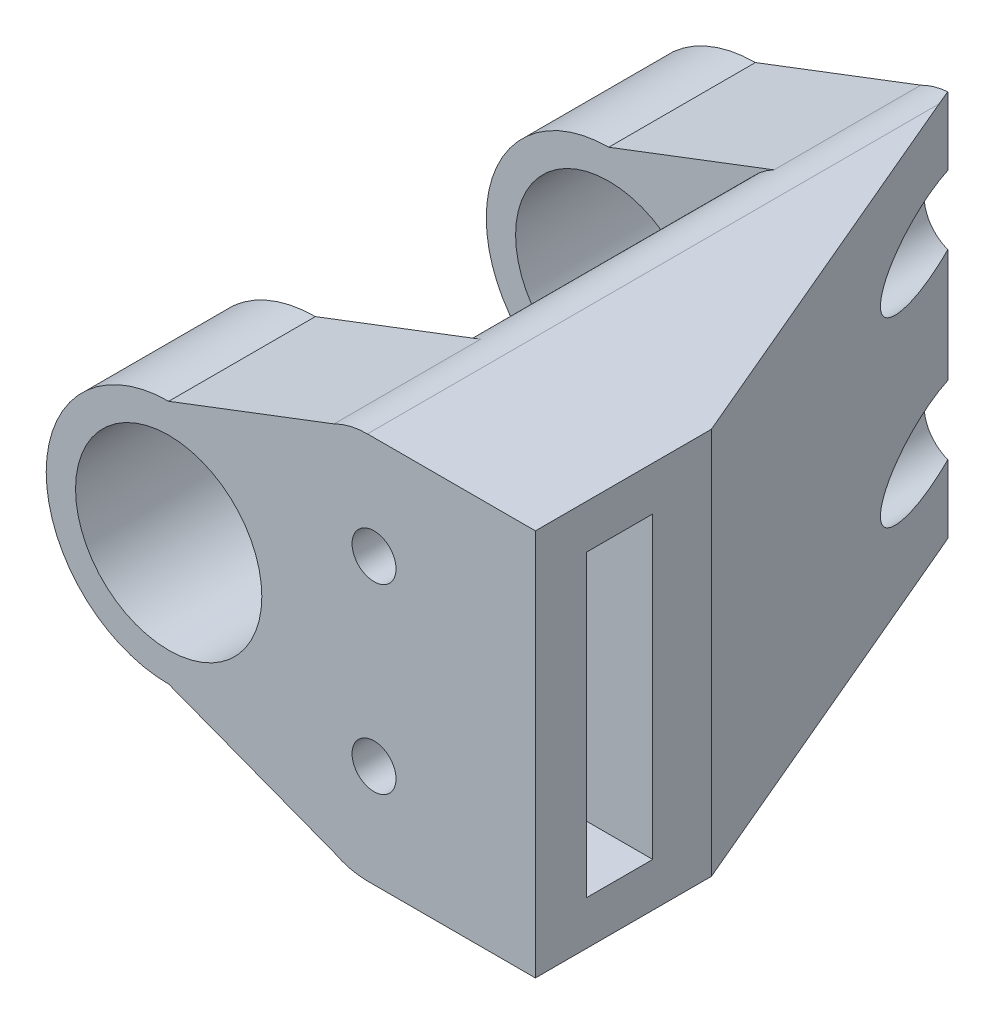
from build123d import *

# Parameters (mm, degrees)
SKETCH1_R               = 6.35
SKETCH1_W               = 15
SKETCH1_H               = 20.4
SKETCH1_R_2             = 1.5
BOSS_EXTRUDE1_DEPTH     = 40
CUT_EXTRUDE1_START      = -3.5
SKETCH1_7_W             = 15
SKETCH1_7_H             = 20.4
SKETCH1_7_R             = 1.5
CUT_EXTRUDE1_DEPTH      = 4.5
CUT_EXTRUDE2_START      = -10
CUT_EXTRUDE2_DEPTH      = 20
FILLET1_R               = 5
CUT_EXTRUDE3_DEPTH      = 39.804456485
CUT_EXTRUDE3_DEPTH_BACK = 39.804456485
CHAMFER1_SIZE           = 28
CHAMFER1_SIZE_2         = 11.885294854
CUT_EXTRUDE5_DEPTH      = 46.945211938
CUT_EXTRUDE5_DEPTH_BACK = 20
SKETCH5_R               = 2.5


with BuildPart() as part:
    # Sketch1 → Boss-Extrude1 (new body)
    # profile 1 of 2: a face of its own
    with BuildSketch(Plane.XY):
        Polygon((-20.773681501, -13.2), (-15, -13.2), (15, -13.2), (15, -10.2), (0, -10.2), (0, 10.2), (15, 10.2), (15, 13.2), (-14.707827622, 13.2), (-15, 13.2), (-20.773681501, 13.2), align=None)
        with Locations((-10, 0)):
            Circle(SKETCH1_R, mode=Mode.SUBTRACT)
    # profile 2 of 2: a face of its own
    with BuildSketch(Plane.XY):
        with Locations((7.5, 0)):
            Rectangle(SKETCH1_W, SKETCH1_H)
        with Locations((4, -6.2)):
            Circle(SKETCH1_R_2, mode=Mode.SUBTRACT)
        with Locations((4, 6.2)):
            Circle(SKETCH1_R_2, mode=Mode.SUBTRACT)
    extrude(amount=-BOSS_EXTRUDE1_DEPTH)

    # Sketch1<7> → Cut-Extrude1 (cut)
    with BuildSketch(Plane.XY.offset(CUT_EXTRUDE1_START)):
        with Locations((7.5, 0)):
            Rectangle(SKETCH1_7_W, SKETCH1_7_H)
        with Locations((4, -6.2)):
            Circle(SKETCH1_7_R, mode=Mode.SUBTRACT)
        with Locations((4, 6.2)):
            Circle(SKETCH1_7_R, mode=Mode.SUBTRACT)
    extrude(amount=-CUT_EXTRUDE1_DEPTH, mode=Mode.SUBTRACT)

    # Sketch2 → Cut-Extrude2 (cut)
    with BuildSketch(Plane.XY.offset(CUT_EXTRUDE2_START)):
        with BuildLine():
            Line((-0.235583945, 2.157818136), (-2.675772908, 13.2))
            Line((-2.675772908, 13.2), (-11.927619652, 13.2))
            Line((-11.927619652, 13.2), (-20.773681501, 13.2))
            Line((-20.773681501, 13.2), (-20.773681501, -13.2))
            Line((-20.773681501, -13.2), (-2.675772908, -13.2))
            Line((-2.675772908, -13.2), (-0.235583945, -2.157818136))
            ThreePointArc((-0.235583945, -2.157818136), (0, 0), (-0.235583945, 2.157818136))
        make_face()
    extrude(amount=-CUT_EXTRUDE2_DEPTH, mode=Mode.SUBTRACT)

    # Fillet1
    fillet1_edges = [part.edges().sort_by_distance(p)[0] for p in [
        (-2.675772908, 13.2, -20),
        (-2.675772908, -13.2, -20),
    ]]
    fillet(fillet1_edges, radius=FILLET1_R)

    # Sketch3 → Cut-Extrude3 (cut, two sides: drawn at the far end of the back side and taken through both)
    with BuildSketch(Plane.XY.offset(-30).offset(-CUT_EXTRUDE3_DEPTH_BACK)):
        with BuildLine():
            Line((-10, 8.35), (1.266113946, 12.648007971))
            ThreePointArc((1.266113946, 12.648007971), (2.375075148, 13.060043202), (3.549800678, 13.2))
            Line((3.549800678, 13.2), (-20.773681501, 13.2))
            Line((-20.773681501, 13.2), (-20.773681501, -13.2))
            Line((-20.773681501, -13.2), (3.549800678, -13.2))
            ThreePointArc((3.549800678, -13.2), (2.375075148, -13.060043202), (1.266113946, -12.648007971))
            Line((1.266113946, -12.648007971), (-10, -8.35))
            ThreePointArc((-10, -8.35), (-18.35, 0), (-10, 8.35))
        make_face()
    extrude(amount=CUT_EXTRUDE3_DEPTH + CUT_EXTRUDE3_DEPTH_BACK, mode=Mode.SUBTRACT)

    # Chamfer1
    # the kernel refuses this chamfer: 28, 11.885294854 mm, written as the material it takes off along each edge
    with BuildSketch(Plane(origin=(15, 85.785659069, -40), x_dir=(0.01507249742986372, 0, 0.9998864034585262), z_dir=(0, -1, 0))) as chamfer1_piece_1:
        Polygon((CHAMFER1_SIZE * 0.999886403459, CHAMFER1_SIZE * 0.0150724974299), (-CHAMFER1_SIZE_2 * 0.0150724974297, CHAMFER1_SIZE_2 * 0.999886403448), (0, 0), align=None)
    extrude(amount=171.571318139, mode=Mode.SUBTRACT)

    # Sketch5 → Cut-Extrude5 (cut, two sides: drawn at the far end of the back side and taken through both)
    with BuildSketch(Plane(origin=(0, 0, -40), x_dir=(-1, 0, 0), z_dir=(0, 0, -1)).offset(-CUT_EXTRUDE5_DEPTH_BACK)):
        with Locations(Location((-4, 6.2, 0), (0, 0, 290.739394744))):
            Circle(SKETCH5_R)
        with Locations(Location((-4, -6.2, 0), (0, 0, 290.739394744))):
            Circle(SKETCH5_R)
    extrude(amount=CUT_EXTRUDE5_DEPTH + CUT_EXTRUDE5_DEPTH_BACK, mode=Mode.SUBTRACT)


solid = part.part
